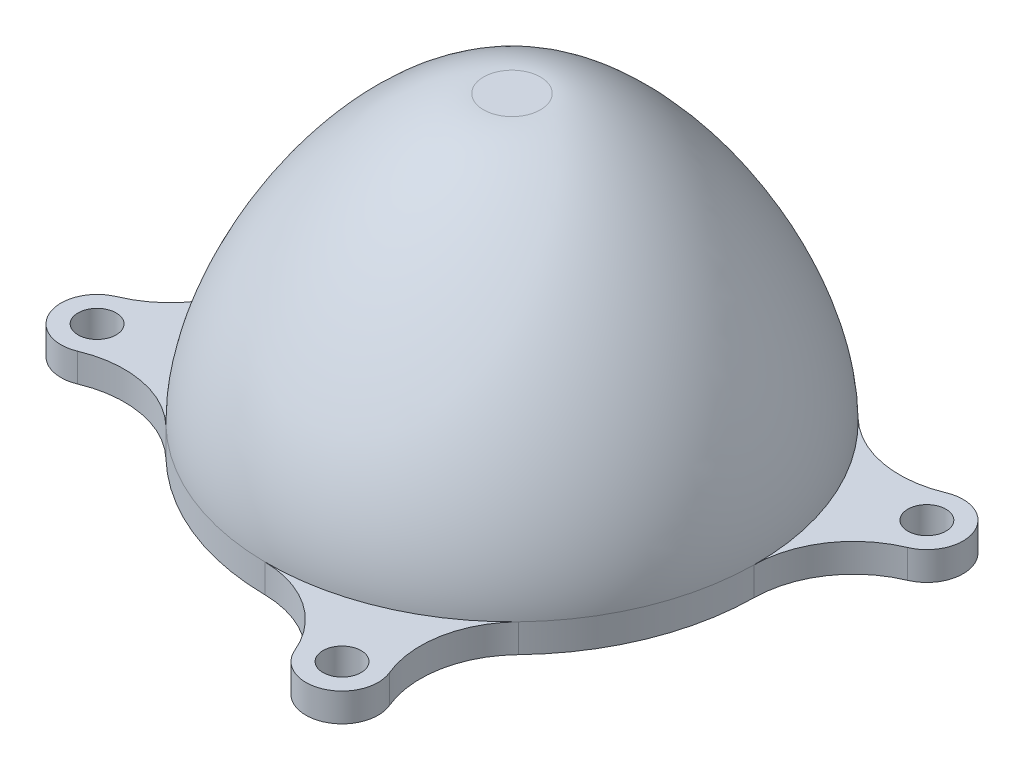
from build123d import *

# Parameters (mm, degrees)
THREAD2_PITCH       = 1
THREAD2_TO          = 5
SKETCH5_R           = 3.35
BOSS_EXTRUDE1_DEPTH = 5


with BuildPart() as part:
    # Sketch1 → Revolve1 (revolve)
    with BuildSketch(Plane.XY, mode=Mode.PRIVATE) as revolve1_sk:
        with BuildLine():
            Line((0, 50), (0, 40))
            add(Edge.make_bspline(
                [(0, 40), (33, 40), (33, 0)],
                knots=[0, 0, 0, 1, 1, 1], degree=2, weights=[1, 0.428571429, 1]))
            Line((33, 0), (33, -2.5))
            Line((33, -2.5), (35, -2.5))
            ThreePointArc((35, -2.5), (35.76, -1.74), (36.52, -2.5))
            Line((36.52, -2.5), (38, -2.5))
            Line((38, -2.5), (38, 0))
            Line((38, 0), (39, 0))
            Line((39, 0), (41, 0))
            Line((41, 0), (41, -5))
            Line((41, -5), (43, -5))
            Line((43, -5), (43, 0))
            add(Edge.make_bspline(
                [(5, 50), (43, 50), (43, 0)],
                knots=[0, 0, 0, 1, 1, 1], degree=2, weights=[1, 0.428571429, 1]))
            Line((5, 50), (0, 50))
        make_face()
    revolve(revolve1_sk.sketch.rotate(Axis((0, 40, 0), (0, -1, 0)), 180), axis=Axis((0, 40, 0), (0, -1, 0)))

    # Thread2: arcs per turn and ends read off the stored shape
    # Thread2: the profile of Thread Profile3 profile screwed along a right-hand helix through 5 turns, 8 arcs to a turn; built about Z, then put on its axis
    thread2_z = Axis((0, 0, 0), (0, 0, 1))
    thread2_corners = [(41.0003, 0, -0.000173205), (41.0003, 0, 0.875173202), (40.458734125, 0, 0.562499999), (40.458734125, 0, 0.312499999)]
    with BuildLine(mode=Mode.PRIVATE) as thread2_profile:
        Line(thread2_corners[0], thread2_corners[1])
        Line(thread2_corners[1], thread2_corners[2])
        Line(thread2_corners[2], thread2_corners[3])
        Line(thread2_corners[3], thread2_corners[0])
    thread2_cap = Face(thread2_profile.wire())
    thread2_turn_angles = [0, 22.5, 45, 67.5, 90, 112.5, 135, 157.5, 180, 202.5, 225, 247.5, 270, 292.5, 315, 337.5, 360]
    thread2_turn_weights = [1, 0.9238795325112867, 1, 0.9238795325112867, 1, 0.9238795325112867, 1, 0.9238795325112867, 1, 0.9238795325112867, 1, 0.9238795325112867, 1, 0.9238795325112867, 1, 0.9238795325112867, 1]
    thread2_turn_rails = [Edge.make_bspline([Vector(p[0], p[1], 0).rotate(thread2_z, thread2_turn_angles[k]) / thread2_turn_weights[k] + Vector(0, 0, p[2] + THREAD2_PITCH * thread2_turn_angles[k] / 360) for k in range(17)], [0, 0, 0, 1, 1, 2, 2, 3, 3, 4, 4, 5, 5, 6, 6, 7, 7, 8, 8, 8], 2, thread2_turn_weights) for p in thread2_corners]
    thread2_turn_sides = [Face.make_surface_from_curves(thread2_turn_rails[p[0]], thread2_turn_rails[p[1]]) for p in [(0, 1), (1, 2), (2, 3), (3, 0)]]
    thread2 = Plane(origin=(0, 0, 0), x_dir=(-1, 0, 0), z_dir=(0, -1, 0)) * split(Solid(Shell([*[p.moved(Location((0, 0, THREAD2_PITCH * i))) for i in range(5) for p in thread2_turn_sides], thread2_cap, thread2_cap.rotate(thread2_z, 1800).moved(Location((0, 0, THREAD2_PITCH * 1800 / 360)))])), bisect_by=Plane.XY.offset(THREAD2_TO), keep=Keep.BOTTOM, mode=Mode.PRIVATE)
    add(thread2)

    # Sketch5 → Boss-Extrude1 (add)
    # profile 1 of 4: a face of its own
    with BuildSketch(Plane(origin=(0, 0, 0), x_dir=(1, 0, 0), z_dir=(0, 1, 0))):
        with BuildLine():
            ThreePointArc((27.37435038, -48.922974575), (26.306431646, -38.851460326), (30.950338066, -29.850905741))
            ThreePointArc((30.950338066, -29.850905741), (16.611200442, -39.661921535), (-0.439874209, -42.997750065))
            ThreePointArc((-0.439874209, -42.997750065), (9.232103862, -46.002527906), (15.660247973, -53.82907331))
            ThreePointArc((15.660247973, -53.82907331), (23.970348545, -57.233075146), (27.37435038, -48.922974575))
        make_face()
        with Locations(Location((21.517299177, -51.376023942, 0), (0, 0, 270))):
            Circle(SKETCH5_R, mode=Mode.SUBTRACT)
    # profile 2 of 4: a face of its own
    with BuildSketch(Plane(origin=(0, 0, 0), x_dir=(1, 0, 0), z_dir=(0, 1, 0))):
        with BuildLine():
            ThreePointArc((-53.82907331, -15.660247973), (-46.002527906, -9.232103862), (-42.997750065, 0.439874209))
            ThreePointArc((-42.997750065, 0.439874209), (-39.661921535, -16.611200442), (-29.850905741, -30.950338066))
            ThreePointArc((-29.850905741, -30.950338066), (-38.851460326, -26.306431646), (-48.922974575, -27.37435038))
            ThreePointArc((-48.922974575, -27.37435038), (-57.233075146, -23.970348545), (-53.82907331, -15.660247973))
        make_face()
        with Locations(Location((-51.376023942, -21.517299177, 0), (0, 0, 270))):
            Circle(SKETCH5_R, mode=Mode.SUBTRACT)
    # profile 3 of 4: a face of its own
    with BuildSketch(Plane(origin=(0, 0, 0), x_dir=(1, 0, 0), z_dir=(0, 1, 0))):
        with BuildLine():
            ThreePointArc((-15.660247973, 53.82907331), (-9.232103862, 46.002527906), (0.439874209, 42.997750065))
            ThreePointArc((0.439874209, 42.997750065), (-16.611200442, 39.661921535), (-30.950338066, 29.850905741))
            ThreePointArc((-30.950338066, 29.850905741), (-26.306431646, 38.851460326), (-27.37435038, 48.922974575))
            ThreePointArc((-27.37435038, 48.922974575), (-23.970348545, 57.233075146), (-15.660247973, 53.82907331))
        make_face()
        with Locations(Location((-21.517299177, 51.376023942, 0), (0, 0, 270))):
            Circle(SKETCH5_R, mode=Mode.SUBTRACT)
    # profile 4 of 4: a face of its own
    with BuildSketch(Plane(origin=(0, 0, 0), x_dir=(1, 0, 0), z_dir=(0, 1, 0))):
        with BuildLine():
            ThreePointArc((53.82907331, 15.660247973), (46.002527906, 9.232103862), (42.997750065, -0.439874209))
            ThreePointArc((42.997750065, -0.439874209), (39.661921535, 16.611200442), (29.850905741, 30.950338066))
            ThreePointArc((29.850905741, 30.950338066), (38.851460326, 26.306431646), (48.922974575, 27.37435038))
            ThreePointArc((48.922974575, 27.37435038), (57.233075146, 23.970348545), (53.82907331, 15.660247973))
        make_face()
        with Locations(Location((51.376023942, 21.517299177, 0), (0, 0, 270))):
            Circle(SKETCH5_R, mode=Mode.SUBTRACT)
    extrude(amount=-BOSS_EXTRUDE1_DEPTH)


solid = part.part
